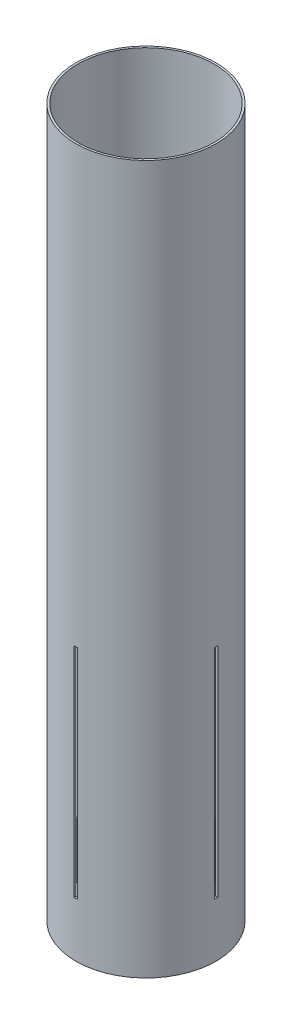
from build123d import *

# Parameters (mm, degrees)
SKETCH1_R           = 65.405
SKETCH1_R_2         = 63.5
BOSS_EXTRUDE1_DEPTH = 330.2
SKETCH4_W           = 3.175
SKETCH4_H           = 203.2
CUT_EXTRUDE2_DEPTH  = 343.91058317
CIRPATTERN4_COUNT   = 2
CIRPATTERN4_ANGLE   = 90


with BuildPart() as part:
    # Sketch1 → Boss-Extrude1 (new, symmetric)
    with BuildSketch(Plane(origin=(0, 0, 0), x_dir=(1, 0, 0), z_dir=(0, 1, 0))):
        Circle(SKETCH1_R)
        Circle(SKETCH1_R_2, mode=Mode.SUBTRACT)
    extrude(amount=BOSS_EXTRUDE1_DEPTH, both=True)

    # Sketch4 → Cut-Extrude2 (cut, symmetric)
    with BuildSketch(Plane(origin=(0, 0, 0), x_dir=(0, 0, -1), z_dir=(1, 0, 0))):
        with Locations((0, -177.8)):
            Rectangle(SKETCH4_W, SKETCH4_H)
    cut_extrude2 = extrude(amount=CUT_EXTRUDE2_DEPTH, both=True, mode=Mode.SUBTRACT)

    # CirPattern4: Cut-Extrude2 ×2 about axis
    cirpattern4_axis = Axis((0, 330.2, 0), (0, 1, 0))
    for i in range(1, CIRPATTERN4_COUNT):
        add(cut_extrude2.rotate(cirpattern4_axis, i * CIRPATTERN4_ANGLE / (CIRPATTERN4_COUNT - 1)), mode=Mode.SUBTRACT)


solid = part.part
